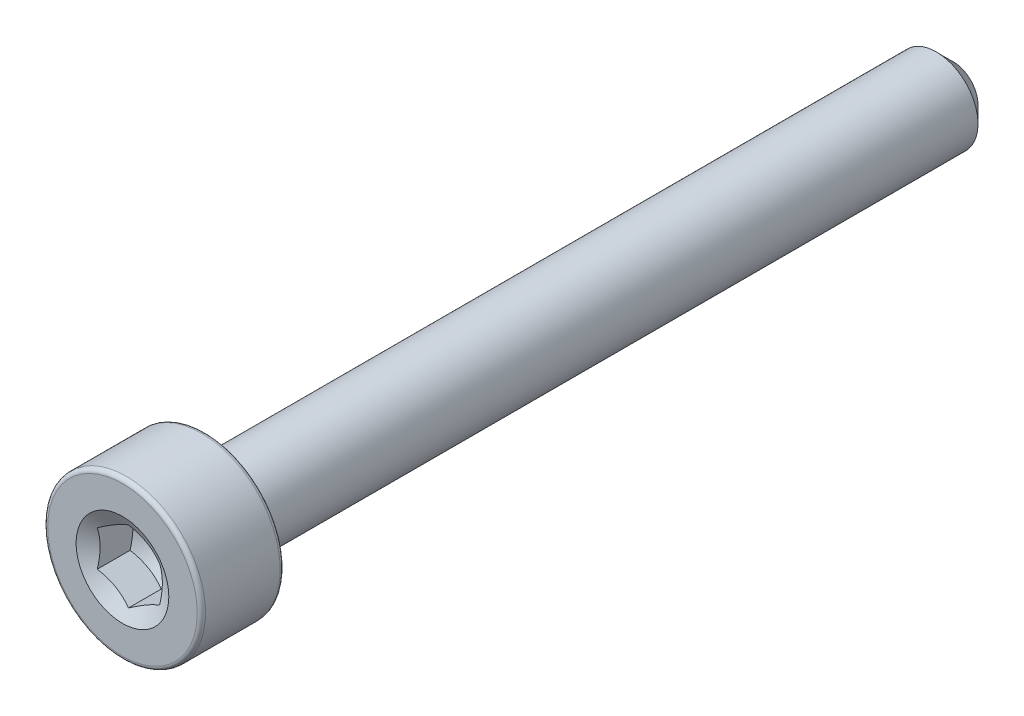
from build123d import *

# Parameters (mm, degrees)
CUT_EXTRUDE1_REACH = 22.355
CUT_EXTRUDE1_START = 10


with BuildPart() as part:
    # Sketch2 → Revolve1 (revolve)
    with BuildSketch(Plane(origin=(0, 0, 0), x_dir=(0, 0, -1), z_dir=(1, 0, 0))):
        with BuildLine():
            Line((10, 0), (10, 0.6))
            Line((10, 0.6), (9.6, 1))
            Line((9.6, 1), (-8, 1))
            Line((-8, 1), (-8, 1.8))
            ThreePointArc((-8, 1.8), (-8.029289322, 1.870710678), (-8.1, 1.9))
            Line((-8.1, 1.9), (-9.9, 1.9))
            ThreePointArc((-9.9, 1.9), (-9.970710678, 1.870710678), (-10, 1.8))
            Line((-10, 1.8), (-10, 0.75))
            Line((-10, 0.75), (-9, 0.75))
            Line((-9, 0.75), (-8.566987298, 0))
            Line((-8.566987298, 0), (10, 0))
        make_face()
    revolve(axis=Axis((0, 0, -10), (0, 0, 1)))

    # Cut-Extrude1: up to this cone (the profile starts inside it)
    cut_extrude1_end = Plane(origin=(0, 0, 10), z_dir=(0, 0, 1)).offset(-1.433011702) * Cone(1.732e-06, 46.36711012, 26.770062509, align=(Align.CENTER, Align.CENTER, Align.MIN), mode=Mode.PRIVATE)
    # Sketch3 → Cut-Extrude1 (cut, up to the surface)
    with BuildSketch(Plane.XY.offset(CUT_EXTRUDE1_START), mode=Mode.PRIVATE) as cut_extrude1_sk1:
        Polygon((-0.75, 0.433012702), (-0.75, -0.433012702), (0, -0.866025404), (0.75, -0.433012702), (0.75, 0.433012702), (0, 0.866025404), align=None)
    cut_extrude1_tool1 = extrude(cut_extrude1_sk1.sketch, amount=-CUT_EXTRUDE1_REACH, mode=Mode.PRIVATE) & cut_extrude1_end
    add(cut_extrude1_tool1.solids().sort_by_distance((0, 0, 10))[0], mode=Mode.SUBTRACT)

    # Cut-Extrude2 cone 1 section (through the dimple's axis) → Cut-Extrude2 (revolve, cut)
    with BuildSketch(Plane(origin=(0, 0, 10), x_dir=(0, -1, 0), z_dir=(1, 0, 0))):
        Polygon((0, 0), (1.116025404, 0), (0, 0.644337567), align=None)
    revolve(axis=Axis((0, 0, 10), (0, 0, -1)), mode=Mode.SUBTRACT)


solid = part.part
